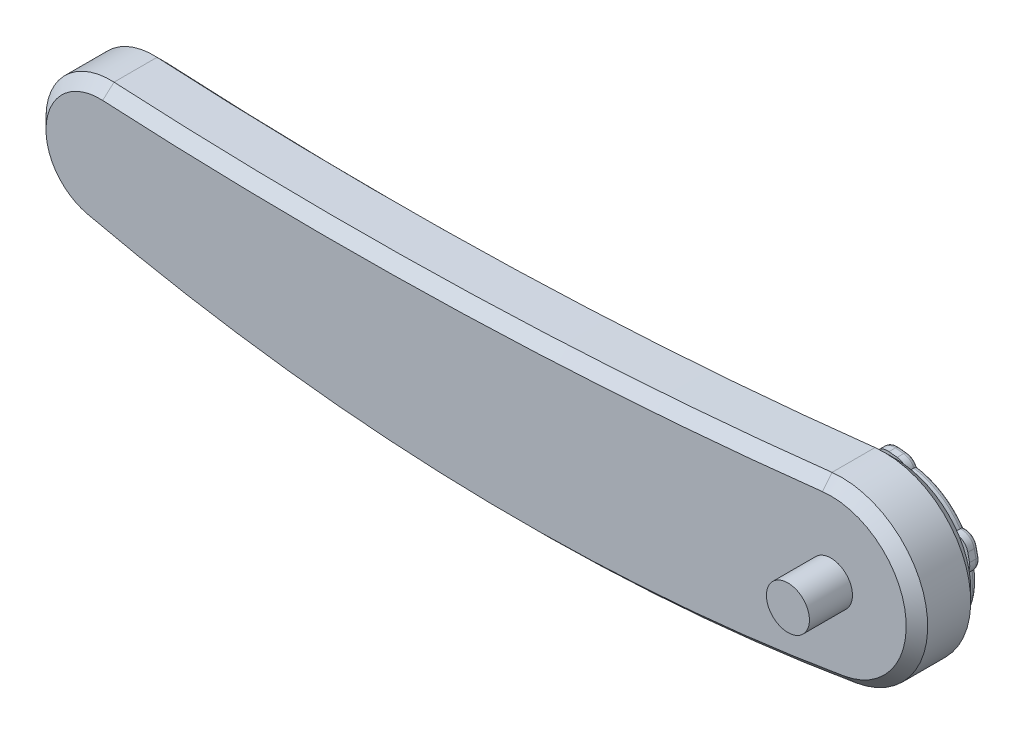
from build123d import *

# Parameters (mm, degrees)
BOSS_EXTRUDE2_DEPTH = 7.5
CHAMFER1_SIZE       = 2.5
SKETCH3_R           = 16.5
BOSS_EXTRUDE3_DEPTH = 2.5
BOSS_EXTRUDE5_DEPTH = 2.5
FILLET5_R           = 1
SKETCH7_R           = 5
CUT_EXTRUDE1_DEPTH  = 10
SKETCH8_R           = 5
BOSS_EXTRUDE6_DEPTH = 10


with BuildPart() as part:
    # Sketch1 → Boss-Extrude2 (new, symmetric)
    with BuildSketch(Plane.XY):
        with BuildLine():
            ThreePointArc((82.746539792, 19.872642429), (-0.617423728, 13.934366249), (-84.186105477, 14.977902914))
            ThreePointArc((-84.186105477, 14.977902914), (-99.852333231, 2.099570811), (-88.369675456, -14.61660998))
            ThreePointArc((-88.369675456, -14.61660998), (-0.256800738, -25.931146508), (88.361833105, -19.715427415))
            ThreePointArc((88.361833105, -19.715427415), (104.801791361, 2.808746854), (82.746539792, 19.872642429))
        make_face()
    extrude(amount=BOSS_EXTRUDE2_DEPTH, both=True)

    # Chamfer1
    chamfer1_edges = [part.edges().sort_by_distance(p)[0] for p in [
        (104.801791361, 2.808746854, 7.5),
        (-0.617423728, 13.934366249, 7.5),
        (-99.852333231, 2.099570811, 7.5),
        (-0.256800738, -25.931146508, 7.5),
        (-99.852333231, 2.099570811, -7.5),
        (-0.617423728, 13.934366249, -7.5),
        (104.801791361, 2.808746854, -7.5),
        (-0.256800738, -25.931146508, -7.5),
    ]]
    chamfer(chamfer1_edges, length=CHAMFER1_SIZE)

    # Sketch3 → Boss-Extrude3 (add, symmetric)
    with BuildSketch(Plane(origin=(0, 0, -7.5), x_dir=(-1, 0, 0), z_dir=(0, 0, -1))):
        with Locations(Location((-85, 0, 0), (0, 0, 180))):
            Circle(SKETCH3_R)
    extrude(amount=BOSS_EXTRUDE3_DEPTH, both=True)

    # Sketch4 → Boss-Extrude5 (add)
    with BuildSketch(Plane(origin=(0, 0, -10), x_dir=(-1, 0, 0), z_dir=(0, 0, -1))):
        with BuildLine():
            ThreePointArc((-83, 0), (-83.000002562, -0.003200998), (-83.000010246, -0.006401988))
            Line((-83.000010246, -0.006401988), (-69.992148283, -0.048040289))
            ThreePointArc((-69.992148283, -0.048040289), (-69.222420502, 0.049839883), (-68.503541809, 0.341858391))
            ThreePointArc((-68.503541809, 0.341858391), (-68.660652518, 2.296894393), (-69.048635628, 4.21947564))
            Line((-69.048635628, 4.21947564), (-83.066501288, 0.511451593))
            ThreePointArc((-83.066501288, 0.511451593), (-83.016695003, 0.257878437), (-83, 0))
        make_face()
        with BuildLine():
            Line((-72.257407456, 7.302653999), (-83.264757072, 0.994450593))
            ThreePointArc((-83.264757072, 0.994450593), (-83.149800467, 0.759448278), (-83.066501288, 0.511451593))
            Line((-83.066501288, 0.511451593), (-69.048635628, 4.21947564))
            ThreePointArc((-69.048635628, 4.21947564), (-69.624139876, 5.98606093), (-70.394604311, 7.676745193))
            ThreePointArc((-70.394604311, 7.676745193), (-71.356403527, 7.641065969), (-72.257407456, 7.302653999))
        make_face()
        with BuildLine():
            Line((-67.452313335, 4.641736889), (-69.048635628, 4.21947564))
            ThreePointArc((-69.048635628, 4.21947564), (-68.660652518, 2.296894393), (-68.503541809, 0.341858391))
            ThreePointArc((-68.503541809, 0.341858391), (-67.13202017, 2.016793833), (-67.244824085, 4.178680883))
            Line((-67.244824085, 4.178680883), (-67.452313335, 4.641736889))
        make_face()
        with BuildLine():
            ThreePointArc((-70.394604311, 7.676745193), (-69.624139876, 5.98606093), (-69.048635628, 4.21947564))
            Line((-69.048635628, 4.21947564), (-67.452313335, 4.641736889))
            Line((-67.452313335, 4.641736889), (-68.02801035, 5.926526149))
            ThreePointArc((-68.02801035, 5.926526149), (-68.981901031, 7.111832024), (-70.394604311, 7.676745193))
        make_face()
        with BuildLine():
            ThreePointArc((-85.409559162, 1.957616227), (-84.88893541, 1.996913783), (-84.375880525, 1.900124965))
            Line((-84.375880525, 1.900124965), (-80.316629741, 14.258469905))
            ThreePointArc((-80.316629741, 14.258469905), (-80.17186035, 15.020771163), (-80.227440722, 15.794704111))
            ThreePointArc((-80.227440722, 15.794704111), (-83.980346955, 16.468464035), (-87.787703063, 16.262801469))
            ThreePointArc((-87.787703063, 16.262801469), (-88.050982407, 15.33705057), (-88.007559024, 14.375569864))
            Line((-88.007559024, 14.375569864), (-85.409559162, 1.957616227))
        make_face()
        with BuildLine():
            ThreePointArc((-87.787703063, 16.262801469), (-83.980346955, 16.468464035), (-80.227440722, 15.794704111))
            ThreePointArc((-80.227440722, 15.794704111), (-81.396575494, 17.616682219), (-83.487510587, 18.177459159))
            Line((-83.487510587, 18.177459159), (-85.391828083, 17.972718648))
            ThreePointArc((-85.391828083, 17.972718648), (-86.81388939, 17.43179436), (-87.787703063, 16.262801469))
        make_face()
        with BuildLine():
            ThreePointArc((-86.988364411, 0.215422773), (-86.86485702, 0.722708998), (-86.614262705, 1.180743799))
            Line((-86.614262705, 1.180743799), (-97.113369715, 8.860259318))
            ThreePointArc((-97.113369715, 8.860259318), (-97.793625092, 9.233507233), (-98.546854344, 9.419805592))
            ThreePointArc((-98.546854344, 9.419805592), (-100.347349914, 6.058782931), (-101.328290932, 2.374218867))
            ThreePointArc((-101.328290932, 2.374218867), (-100.529207299, 1.837752571), (-99.601366244, 1.581936784))
            Line((-99.601366244, 1.581936784), (-86.988364411, 0.215422773))
        make_face()
        with BuildLine():
            ThreePointArc((-101.328290932, 2.374218867), (-100.347349914, 6.058782931), (-98.546854344, 9.419805592))
            ThreePointArc((-98.546854344, 9.419805592), (-100.64094101, 8.870914548), (-101.82040605, 7.055606707))
            Line((-101.82040605, 7.055606707), (-102.214152722, 5.181224846))
            ThreePointArc((-102.214152722, 5.181224846), (-102.139144264, 3.661609376), (-101.328290932, 2.374218867))
        make_face()
        with BuildLine():
            ThreePointArc((-85.819317626, -1.824477632), (-86.263609613, -1.550255058), (-86.621788693, -1.170385165))
            Line((-86.621788693, -1.170385165), (-97.169844461, -8.782528498))
            ThreePointArc((-97.169844461, -8.782528498), (-97.735034796, -9.314149858), (-98.144975703, -9.972944087))
            ThreePointArc((-98.144975703, -9.972944087), (-95.50483693, -12.723930253), (-92.303735712, -14.795453513))
            ThreePointArc((-92.303735712, -14.795453513), (-91.546595522, -14.201257019), (-91.016581597, -13.397879163))
            Line((-91.016581597, -13.397879163), (-85.819317626, -1.824477632))
        make_face()
        with BuildLine():
            ThreePointArc((-92.303735712, -14.795453513), (-95.50483693, -12.723930253), (-98.144975703, -9.972944087))
            ThreePointArc((-98.144975703, -9.972944087), (-98.270057666, -12.134155517), (-96.908072057, -13.816854403))
            Line((-96.908072057, -13.816854403), (-95.247103387, -14.77054559))
            ThreePointArc((-95.247103387, -14.77054559), (-93.778684303, -15.168795312), (-92.303735712, -14.795453513))
        make_face()
        with BuildLine():
            ThreePointArc((-83.51800173, -1.343011961), (-83.916096669, -1.680819315), (-84.38805783, -1.904081611))
            Line((-84.38805783, -1.904081611), (-80.4080078, -14.288160437))
            ThreePointArc((-80.4080078, -14.288160437), (-80.07705926, -14.989968422), (-79.577187422, -15.583424006))
            ThreePointArc((-79.577187422, -15.583424006), (-76.144996354, -13.922604298), (-73.185665982, -11.518312017))
            ThreePointArc((-73.185665982, -11.518312017), (-73.516811244, -10.614612091), (-74.117085679, -9.862281484))
            Line((-74.117085679, -9.862281484), (-83.51800173, -1.343011961))
        make_face()
        with BuildLine():
            ThreePointArc((-73.185665982, -11.518312017), (-76.144996354, -13.922604298), (-79.577187422, -15.583424006))
            ThreePointArc((-79.577187422, -15.583424006), (-77.560405661, -16.370235082), (-75.539187221, -15.594892345))
            Line((-75.539187221, -15.594892345), (-74.118905457, -14.309924053))
            ThreePointArc((-74.118905457, -14.309924053), (-73.286381012, -13.036440447), (-73.185665982, -11.518312017))
        make_face()
    extrude(amount=-BOSS_EXTRUDE5_DEPTH)

    # Fillet5
    # the kernel refuses this fillet: 1 mm, written as the material it takes off along each edge
    with BuildSketch(Plane(origin=(85, 0, -10), x_dir=(0.6962981474902139, -0.7177526661752616, 0), z_dir=(-0.7177526661752616, -0.6962981474902139, 0))) as fillet5_piece_1_section:
        with BuildLine():
            CenterArc((16.5 - FILLET5_R, FILLET5_R), FILLET5_R, 270, 90)
            Line((16.5, FILLET5_R), (16.5, 0))
            Line((16.5, 0), (16.5 - FILLET5_R, 0))
        make_face()
    fillet5_piece_1 = revolve(axis=Axis((85, 0, -10), (0, 0, 1)), revolution_arc=62.824440694, mode=Mode.PRIVATE)
    fillet5_piece_1 = fillet5_piece_1 - Plane(origin=(95.414266714, -11.215211538, -9.717562779), x_dir=(0.5851925824459815, 0.810894346663117, 0), z_dir=(0, 0, -1)) * Cylinder(3, 67, mode=Mode.PRIVATE)
    fillet5_piece_1 = fillet5_piece_1 - Plane(origin=(99.278232085, 4.5644834, -9.717562779), x_dir=(0.6833529490697156, -0.7300881775496182, 0), z_dir=(0, 0, -1)) * Cylinder(3, 67, mode=Mode.PRIVATE)
    add(fillet5_piece_1, mode=Mode.SUBTRACT)
    with BuildSketch(Plane(origin=(98.884485413, 6.43886526, -10), x_dir=(-0.8113230423185704, 0.5845980850147727, 0), z_dir=(-0.5845980850147727, -0.8113230423185704, 0))) as fillet5_piece_2_section:
        with BuildLine():
            CenterArc((3 - FILLET5_R, -FILLET5_R), FILLET5_R, 0, 90)
            Line((3, -FILLET5_R), (3, 0))
            Line((3, 0), (3 - FILLET5_R, 0))
        make_face()
    fillet5_piece_2 = revolve(axis=Axis((98.884485413, 6.43886526, -10), (0, 0, -1)), revolution_arc=132.361916339, mode=Mode.PRIVATE)
    fillet5_piece_2 = fillet5_piece_2 - Plane(origin=(85, 0, -9.714209438), x_dir=(1, 0, 0), z_dir=(0, 0, -1)) * Cylinder(16.5, 12, mode=Mode.PRIVATE)
    add(fillet5_piece_2, mode=Mode.SUBTRACT)
    with BuildSketch(Plane(origin=(101.82040605, 7.055606707, -10), x_dir=(-0.9786402124130847, -0.20558048216713717, 0), z_dir=(0.20558048216713717, -0.9786402124130846, 0)), Plane(origin=(96.908072057, -13.816854403, -10), x_dir=(-0.497935114202508, 0.8672142884224956, 0), z_dir=(-0.8672142884224956, -0.497935114202508, 0)), Plane(origin=(75.539187221, -15.594892345, -10), x_dir=(0.6708993876438742, 0.7415483879417947, 0), z_dir=(-0.7415483879417948, 0.6708993876438744, 0)), Plane(origin=(67.244824085, 4.178680883, -10), x_dir=(0.9125737387979128, -0.4089121803717751, 0), z_dir=(0.40891218037177507, 0.9125737387979127, 0)), Plane(origin=(83.487510587, 18.177459159, -10), x_dir=(-0.10689779982619077, -0.9942700138253792, 0), z_dir=(0.9942700138253792, -0.10689779982619077, 0))) as fillet5_piece_3:
        with BuildLine():
            CenterArc((FILLET5_R, -FILLET5_R), FILLET5_R, 90, 90)
            Line((0, -FILLET5_R), (0, 0))
            Line((0, 0), (FILLET5_R, 0))
        make_face()
    extrude(amount=1.915292093, mode=Mode.SUBTRACT)
    with BuildSketch(Plane(origin=(99.278232085, 4.5644834, -10), x_dir=(0.9786402124130815, 0.20558048216715175, 0), z_dir=(-0.20558048216715175, 0.9786402124130815, 0))) as fillet5_piece_4_section:
        with BuildLine():
            CenterArc((3 - FILLET5_R, -FILLET5_R), FILLET5_R, 0, 90)
            Line((3, -FILLET5_R), (3, 0))
            Line((3, 0), (3 - FILLET5_R, 0))
        make_face()
    fillet5_piece_4 = revolve(axis=Axis((99.278232085, 4.5644834, -10), (0, 0, -1)), revolution_arc=106.511925479, mode=Mode.PRIVATE)
    fillet5_piece_4 = fillet5_piece_4 - Plane(origin=(85, 0, -9.755871089), x_dir=(1, 0, 0), z_dir=(0, 0, -1)) * Cylinder(16.5, 12, mode=Mode.PRIVATE)
    add(fillet5_piece_4, mode=Mode.SUBTRACT)
    with BuildSketch(Plane(origin=(85, 0, -10), x_dir=(0.5729356734590134, -0.8196003380172965, 0), z_dir=(0.8196003380172965, 0.5729356734590134, 0))) as fillet5_piece_5_section:
        with BuildLine():
            CenterArc((16.5 - FILLET5_R, -FILLET5_R), FILLET5_R, 0, 90)
            Line((16.5, -FILLET5_R), (16.5, 0))
            Line((16.5, 0), (16.5 - FILLET5_R, 0))
        make_face()
    fillet5_piece_5 = revolve(axis=Axis((85, 0, -10), (0, 0, -1)), revolution_arc=62.824440694, mode=Mode.PRIVATE)
    fillet5_piece_5 = fillet5_piece_5 - Plane(origin=(93.753298045, -12.168902725, -9.717562776), x_dir=(-0.48318744431003685, -0.875516929397219, 0), z_dir=(0, 0, -1)) * Cylinder(3, 67, mode=Mode.PRIVATE)
    fillet5_piece_5 = fillet5_piece_5 - Plane(origin=(77.551885384, -13.370247181, -9.717562776), x_dir=(0.9520408053788243, -0.3059710850613826, 0), z_dir=(0, 0, -1)) * Cylinder(3, 67, mode=Mode.PRIVATE)
    add(fillet5_piece_5, mode=Mode.SUBTRACT)
    with BuildSketch(Plane(origin=(95.414266714, -11.215211538, -10), x_dir=(0.30527321016238146, 0.9522648093661523, 0), z_dir=(-0.9522648093661523, 0.30527321016238146, 0))) as fillet5_piece_6_section:
        with BuildLine():
            CenterArc((3 - FILLET5_R, -FILLET5_R), FILLET5_R, 0, 90)
            Line((3, -FILLET5_R), (3, 0))
            Line((3, 0), (3 - FILLET5_R, 0))
        make_face()
    fillet5_piece_6 = revolve(axis=Axis((95.414266714, -11.215211538, -10), (0, 0, -1)), revolution_arc=132.361916339, mode=Mode.PRIVATE)
    fillet5_piece_6 = fillet5_piece_6 - Plane(origin=(85, 0, -9.714209438), x_dir=(1, 0, 0), z_dir=(0, 0, -1)) * Cylinder(16.5, 13, mode=Mode.PRIVATE)
    add(fillet5_piece_6, mode=Mode.SUBTRACT)
    with BuildSketch(Plane(origin=(93.753298045, -12.168902725, -10), x_dir=(-0.9729714728157141, -0.23092534093689285, 0), z_dir=(-0.23092534093689285, 0.9729714728157141, 0))) as fillet5_piece_7_section:
        with BuildLine():
            CenterArc((3 - FILLET5_R, FILLET5_R), FILLET5_R, 270, 90)
            Line((3 - FILLET5_R, 0), (3, 0))
            Line((3, 0), (3, FILLET5_R))
        make_face()
    fillet5_piece_7 = revolve(axis=Axis((93.753298045, -12.168902725, -10), (0, 0, 1)), revolution_arc=106.511925479, mode=Mode.PRIVATE)
    fillet5_piece_7 = fillet5_piece_7 - Plane(origin=(85, 0, -9.755871036), x_dir=(1, 0, 0), z_dir=(0, 0, -1)) * Cylinder(16.5, 12, mode=Mode.PRIVATE)
    add(fillet5_piece_7, mode=Mode.SUBTRACT)
    with BuildSketch(Plane(origin=(85, 0, -10), x_dir=(-0.6024393824466099, -0.7981646387039125, 0), z_dir=(0.7981646387039125, -0.6024393824466099, 0))) as fillet5_piece_8_section:
        with BuildLine():
            CenterArc((16.5 - FILLET5_R, -FILLET5_R), FILLET5_R, 0, 90)
            Line((16.5, -FILLET5_R), (16.5, 0))
            Line((16.5, 0), (16.5 - FILLET5_R, 0))
        make_face()
    fillet5_piece_8 = revolve(axis=Axis((85, 0, -10), (0, 0, -1)), revolution_arc=62.824440694, mode=Mode.PRIVATE)
    fillet5_piece_8 = fillet5_piece_8 - Plane(origin=(76.13160362, -12.085278889, -9.717562776), x_dir=(-0.981979212590304, 0.1889889574565848, 0), z_dir=(0, 0, -1)) * Cylinder(3, 67, mode=Mode.PRIVATE)
    fillet5_piece_8 = fillet5_piece_8 - Plane(origin=(69.982545301, 2.951944342, -9.717562776), x_dir=(0.003200993954957648, -0.9999948768057266, 0), z_dir=(0, 0, -1)) * Cylinder(3, 67, mode=Mode.PRIVATE)
    add(fillet5_piece_8, mode=Mode.SUBTRACT)
    with BuildSketch(Plane(origin=(77.551885384, -13.370247181, -10), x_dir=(0.9999922620538119, 0.003933933464149582, 0), z_dir=(-0.003933933464149582, 0.9999922620538119, 0))) as fillet5_piece_9_section:
        with BuildLine():
            CenterArc((3 - FILLET5_R, -FILLET5_R), FILLET5_R, 0, 90)
            Line((3, -FILLET5_R), (3, 0))
            Line((3, 0), (3 - FILLET5_R, 0))
        make_face()
    fillet5_piece_9 = revolve(axis=Axis((77.551885384, -13.370247181, -10), (0, 0, -1)), revolution_arc=132.361916339, mode=Mode.PRIVATE)
    fillet5_piece_9 = fillet5_piece_9 - Plane(origin=(85, 0, -9.714209438), x_dir=(1, 0, 0), z_dir=(0, 0, -1)) * Cylinder(16.5, 13, mode=Mode.PRIVATE)
    add(fillet5_piece_9, mode=Mode.SUBTRACT)
    with BuildSketch(Plane(origin=(76.13160362, -12.085278889, -10), x_dir=(-0.6708993876438603, -0.7415483879418073, 0), z_dir=(0.7415483879418073, -0.6708993876438603, 0))) as fillet5_piece_10_section:
        with BuildLine():
            CenterArc((3 - FILLET5_R, -FILLET5_R), FILLET5_R, 0, 90)
            Line((3, -FILLET5_R), (3, 0))
            Line((3, 0), (3 - FILLET5_R, 0))
        make_face()
    fillet5_piece_10 = revolve(axis=Axis((76.13160362, -12.085278889, -10), (0, 0, -1)), revolution_arc=106.511925479, mode=Mode.PRIVATE)
    fillet5_piece_10 = fillet5_piece_10 - Plane(origin=(85, 0, -9.755871089), x_dir=(1, 0, 0), z_dir=(0, 0, -1)) * Cylinder(16.5, 12, mode=Mode.PRIVATE)
    add(fillet5_piece_10, mode=Mode.SUBTRACT)
    with BuildSketch(Plane(origin=(85, 0, -10), x_dir=(-0.945263687972474, 0.32630746268002736, 0), z_dir=(-0.32630746268002736, -0.945263687972474, 0))) as fillet5_piece_11_section:
        with BuildLine():
            CenterArc((16.5 - FILLET5_R, -FILLET5_R), FILLET5_R, 0, 90)
            Line((16.5, -FILLET5_R), (16.5, 0))
            Line((16.5, 0), (16.5 - FILLET5_R, 0))
        make_face()
    fillet5_piece_11 = revolve(axis=Axis((85, 0, -10), (0, 0, -1)), revolution_arc=62.824440694, mode=Mode.PRIVATE)
    fillet5_piece_11 = fillet5_piece_11 - Plane(origin=(70.765731567, 4.699789608, -9.717562776), x_dir=(-0.12370908531668448, 0.9923185286036482, 0), z_dir=(0, 0, -1)) * Cylinder(3, 67, mode=Mode.PRIVATE)
    fillet5_piece_11 = fillet5_piece_11 - Plane(origin=(83.166817188, 15.194649118, -9.717562776), x_dir=(-0.9500624823168781, -0.31205973738034826, 0), z_dir=(0, 0, -1)) * Cylinder(3, 67, mode=Mode.PRIVATE)
    add(fillet5_piece_11, mode=Mode.SUBTRACT)
    with BuildSketch(Plane(origin=(69.982545301, 2.951944342, -10), x_dir=(0.31275599627378403, -0.9498335047758596, 0), z_dir=(0.9498335047758596, 0.31275599627378403, 0))) as fillet5_piece_12_section:
        with BuildLine():
            CenterArc((3 - FILLET5_R, -FILLET5_R), FILLET5_R, 0, 90)
            Line((3, -FILLET5_R), (3, 0))
            Line((3, 0), (3 - FILLET5_R, 0))
        make_face()
    fillet5_piece_12 = revolve(axis=Axis((69.982545301, 2.951944342, -10), (0, 0, -1)), revolution_arc=132.361916339, mode=Mode.PRIVATE)
    fillet5_piece_12 = fillet5_piece_12 - Plane(origin=(85, 0, -9.714209438), x_dir=(1, 0, 0), z_dir=(0, 0, -1)) * Cylinder(16.5, 13, mode=Mode.PRIVATE)
    add(fillet5_piece_12, mode=Mode.SUBTRACT)
    with BuildSketch(Plane(origin=(70.765731567, 4.699789608, -10), x_dir=(-0.9125737387979147, 0.4089121803717705, 0), z_dir=(-0.4089121803717705, -0.9125737387979147, 0))) as fillet5_piece_13_section:
        with BuildLine():
            CenterArc((3 - FILLET5_R, -FILLET5_R), FILLET5_R, 0, 90)
            Line((3, -FILLET5_R), (3, 0))
            Line((3, 0), (3 - FILLET5_R, 0))
        make_face()
    fillet5_piece_13 = revolve(axis=Axis((70.765731567, 4.699789608, -10), (0, 0, -1)), revolution_arc=106.511925479, mode=Mode.PRIVATE)
    fillet5_piece_13 = fillet5_piece_13 - Plane(origin=(85, 0, -9.755871089), x_dir=(1, 0, 0), z_dir=(0, 0, -1)) * Cylinder(16.5, 13, mode=Mode.PRIVATE)
    add(fillet5_piece_13, mode=Mode.SUBTRACT)
    with BuildSketch(Plane(origin=(85, 0, -10), x_dir=(0.01823429494850894, 0.9998337414229083, 0), z_dir=(-0.9998337414229083, 0.01823429494850894, 0))) as fillet5_piece_14_section:
        with BuildLine():
            CenterArc((16.5 - FILLET5_R, -FILLET5_R), FILLET5_R, 0, 90)
            Line((16.5, -FILLET5_R), (16.5, 0))
            Line((16.5, 0), (16.5 - FILLET5_R, 0))
        make_face()
    fillet5_piece_14 = revolve(axis=Axis((85, 0, -10), (0, 0, -1)), revolution_arc=62.824440694, mode=Mode.PRIVATE)
    fillet5_piece_14 = fillet5_piece_14 - Plane(origin=(98.884485413, 6.43886526, -9.717562776), x_dir=(-0.590371899462906, 0.8071313525842994, 0), z_dir=(0, 0, -1)) * Cylinder(3, 67, mode=Mode.PRIVATE)
    fillet5_piece_14 = fillet5_piece_14 - Plane(origin=(85.071134683, 14.989908607, -9.717562776), x_dir=(0.9055227931474359, 0.4242976208871151, 0), z_dir=(0, 0, -1)) * Cylinder(3, 67, mode=Mode.PRIVATE)
    add(fillet5_piece_14, mode=Mode.SUBTRACT)
    with BuildSketch(Plane(origin=(83.166817188, 15.194649118, -10), x_dir=(-0.8066984261714545, -0.5909633230687827, 0), z_dir=(0.5909633230687827, -0.8066984261714545, 0))) as fillet5_piece_15_section:
        with BuildLine():
            CenterArc((3 - FILLET5_R, -FILLET5_R), FILLET5_R, 0, 90)
            Line((3, -FILLET5_R), (3, 0))
            Line((3, 0), (3 - FILLET5_R, 0))
        make_face()
    fillet5_piece_15 = revolve(axis=Axis((83.166817188, 15.194649118, -10), (0, 0, -1)), revolution_arc=132.361916339, mode=Mode.PRIVATE)
    fillet5_piece_15 = fillet5_piece_15 - Plane(origin=(85, 0, -9.714209438), x_dir=(1, 0, 0), z_dir=(0, 0, -1)) * Cylinder(16.5, 12, mode=Mode.PRIVATE)
    add(fillet5_piece_15, mode=Mode.SUBTRACT)
    with BuildSketch(Plane(origin=(85.071134683, 14.989908607, -10), x_dir=(0.106897799826194, 0.9942700138253789, 0), z_dir=(-0.9942700138253789, 0.106897799826194, 0))) as fillet5_piece_16_section:
        with BuildLine():
            CenterArc((3 - FILLET5_R, -FILLET5_R), FILLET5_R, 0, 90)
            Line((3, -FILLET5_R), (3, 0))
            Line((3, 0), (3 - FILLET5_R, 0))
        make_face()
    fillet5_piece_16 = revolve(axis=Axis((85.071134683, 14.989908607, -10), (0, 0, -1)), revolution_arc=106.511925479, mode=Mode.PRIVATE)
    fillet5_piece_16 = fillet5_piece_16 - Plane(origin=(85, 0, -9.755871089), x_dir=(1, 0, 0), z_dir=(0, 0, -1)) * Cylinder(16.5, 13, mode=Mode.PRIVATE)
    add(fillet5_piece_16, mode=Mode.SUBTRACT)
    with BuildSketch(Plane(origin=(85, 0, -10), x_dir=(0.6962981474902139, -0.7177526661752616, 0), z_dir=(-0.7177526661752616, -0.6962981474902139, 0))) as fillet5_piece_17a_section:
        with BuildLine():
            CenterArc((16.5 - FILLET5_R, FILLET5_R), FILLET5_R, 270, 90)
            Line((16.5, FILLET5_R), (16.5, 0))
            Line((16.5, 0), (16.5 - FILLET5_R, 0))
        make_face()
    fillet5_piece_17a = revolve(axis=Axis((85, 0, -10), (0, 0, 1)), revolution_arc=62.824440694, mode=Mode.PRIVATE)
    fillet5_piece_17a = fillet5_piece_17a & Plane(origin=(95.414266714, -11.215211538, -9.776380547), x_dir=(0.5851925824459815, 0.810894346663117, 0), z_dir=(0, 0, -1)) * Cylinder(3, 67, mode=Mode.PRIVATE)
    with BuildSketch(Plane(origin=(95.414266714, -11.215211538, -10), x_dir=(0.30527321016238146, 0.9522648093661523, 0), z_dir=(-0.9522648093661523, 0.30527321016238146, 0))) as fillet5_piece_17b_section:
        with BuildLine():
            CenterArc((3 - FILLET5_R, -FILLET5_R), FILLET5_R, 0, 90)
            Line((3, -FILLET5_R), (3, 0))
            Line((3, 0), (3 - FILLET5_R, 0))
        make_face()
    fillet5_piece_17b = revolve(axis=Axis((95.414266714, -11.215211538, -10), (0, 0, -1)), revolution_arc=132.361916339, mode=Mode.PRIVATE)
    fillet5_piece_17b = fillet5_piece_17b & Plane(origin=(85, 0, -9.770212373), x_dir=(1, 0, 0), z_dir=(0, 0, -1)) * Cylinder(16.5, 13, mode=Mode.PRIVATE)
    fillet5_piece_17 = fillet5_piece_17a & fillet5_piece_17b
    add(fillet5_piece_17, mode=Mode.SUBTRACT)
    with BuildSketch(Plane(origin=(99.278232085, 4.5644834, -10), x_dir=(0.9786402124130815, 0.20558048216715175, 0), z_dir=(-0.20558048216715175, 0.9786402124130815, 0))) as fillet5_piece_18a_section:
        with BuildLine():
            CenterArc((3 - FILLET5_R, -FILLET5_R), FILLET5_R, 0, 90)
            Line((3, -FILLET5_R), (3, 0))
            Line((3, 0), (3 - FILLET5_R, 0))
        make_face()
    fillet5_piece_18a = revolve(axis=Axis((99.278232085, 4.5644834, -10), (0, 0, -1)), revolution_arc=106.511925479, mode=Mode.PRIVATE)
    fillet5_piece_18a = fillet5_piece_18a & Plane(origin=(85, 0, -9.772218446), x_dir=(1, 0, 0), z_dir=(0, 0, -1)) * Cylinder(16.5, 12, mode=Mode.PRIVATE)
    with BuildSketch(Plane(origin=(85, 0, -10), x_dir=(0.6962981474902139, -0.7177526661752616, 0), z_dir=(-0.7177526661752616, -0.6962981474902139, 0))) as fillet5_piece_18b_section:
        with BuildLine():
            CenterArc((16.5 - FILLET5_R, FILLET5_R), FILLET5_R, 270, 90)
            Line((16.5, FILLET5_R), (16.5, 0))
            Line((16.5, 0), (16.5 - FILLET5_R, 0))
        make_face()
    fillet5_piece_18b = revolve(axis=Axis((85, 0, -10), (0, 0, 1)), revolution_arc=62.824440694, mode=Mode.PRIVATE)
    fillet5_piece_18b = fillet5_piece_18b & Plane(origin=(99.278232085, 4.5644834, -9.777758811), x_dir=(0.6833529490697156, -0.7300881775496182, 0), z_dir=(0, 0, -1)) * Cylinder(3, 67, mode=Mode.PRIVATE)
    fillet5_piece_18 = fillet5_piece_18a & fillet5_piece_18b
    add(fillet5_piece_18, mode=Mode.SUBTRACT)
    with BuildSketch(Plane(origin=(85, 0, -10), x_dir=(0.01823429494850894, 0.9998337414229083, 0), z_dir=(-0.9998337414229083, 0.01823429494850894, 0))) as fillet5_piece_19a_section:
        with BuildLine():
            CenterArc((16.5 - FILLET5_R, -FILLET5_R), FILLET5_R, 0, 90)
            Line((16.5, -FILLET5_R), (16.5, 0))
            Line((16.5, 0), (16.5 - FILLET5_R, 0))
        make_face()
    fillet5_piece_19a = revolve(axis=Axis((85, 0, -10), (0, 0, -1)), revolution_arc=62.824440694, mode=Mode.PRIVATE)
    fillet5_piece_19a = fillet5_piece_19a & Plane(origin=(98.884485413, 6.43886526, -9.776380543), x_dir=(-0.590371899462906, 0.8071313525842994, 0), z_dir=(0, 0, -1)) * Cylinder(3, 67, mode=Mode.PRIVATE)
    with BuildSketch(Plane(origin=(98.884485413, 6.43886526, -10), x_dir=(-0.8113230423185704, 0.5845980850147727, 0), z_dir=(-0.5845980850147727, -0.8113230423185704, 0))) as fillet5_piece_19b_section:
        with BuildLine():
            CenterArc((3 - FILLET5_R, -FILLET5_R), FILLET5_R, 0, 90)
            Line((3, -FILLET5_R), (3, 0))
            Line((3, 0), (3 - FILLET5_R, 0))
        make_face()
    fillet5_piece_19b = revolve(axis=Axis((98.884485413, 6.43886526, -10), (0, 0, -1)), revolution_arc=132.361916339, mode=Mode.PRIVATE)
    fillet5_piece_19b = fillet5_piece_19b & Plane(origin=(85, 0, -9.770212373), x_dir=(1, 0, 0), z_dir=(0, 0, -1)) * Cylinder(16.5, 12, mode=Mode.PRIVATE)
    fillet5_piece_19 = fillet5_piece_19a & fillet5_piece_19b
    add(fillet5_piece_19, mode=Mode.SUBTRACT)
    with BuildSketch(Plane(origin=(93.753298045, -12.168902725, -10), x_dir=(-0.9729714728157141, -0.23092534093689285, 0), z_dir=(-0.23092534093689285, 0.9729714728157141, 0))) as fillet5_piece_20a_section:
        with BuildLine():
            CenterArc((3 - FILLET5_R, FILLET5_R), FILLET5_R, 270, 90)
            Line((3 - FILLET5_R, 0), (3, 0))
            Line((3, 0), (3, FILLET5_R))
        make_face()
    fillet5_piece_20a = revolve(axis=Axis((93.753298045, -12.168902725, -10), (0, 0, 1)), revolution_arc=106.511925479, mode=Mode.PRIVATE)
    fillet5_piece_20a = fillet5_piece_20a & Plane(origin=(85, 0, -9.772218525), x_dir=(1, 0, 0), z_dir=(0, 0, -1)) * Cylinder(16.5, 12, mode=Mode.PRIVATE)
    with BuildSketch(Plane(origin=(85, 0, -10), x_dir=(0.5729356734590134, -0.8196003380172965, 0), z_dir=(0.8196003380172965, 0.5729356734590134, 0))) as fillet5_piece_20b_section:
        with BuildLine():
            CenterArc((16.5 - FILLET5_R, -FILLET5_R), FILLET5_R, 0, 90)
            Line((16.5, -FILLET5_R), (16.5, 0))
            Line((16.5, 0), (16.5 - FILLET5_R, 0))
        make_face()
    fillet5_piece_20b = revolve(axis=Axis((85, 0, -10), (0, 0, -1)), revolution_arc=62.824440694, mode=Mode.PRIVATE)
    fillet5_piece_20b = fillet5_piece_20b & Plane(origin=(93.753298045, -12.168902725, -9.777758803), x_dir=(-0.48318744431003685, -0.875516929397219, 0), z_dir=(0, 0, -1)) * Cylinder(3, 67, mode=Mode.PRIVATE)
    fillet5_piece_20 = fillet5_piece_20a & fillet5_piece_20b
    add(fillet5_piece_20, mode=Mode.SUBTRACT)
    with BuildSketch(Plane(origin=(85, 0, -10), x_dir=(0.5729356734590134, -0.8196003380172965, 0), z_dir=(0.8196003380172965, 0.5729356734590134, 0))) as fillet5_piece_21a_section:
        with BuildLine():
            CenterArc((16.5 - FILLET5_R, -FILLET5_R), FILLET5_R, 0, 90)
            Line((16.5, -FILLET5_R), (16.5, 0))
            Line((16.5, 0), (16.5 - FILLET5_R, 0))
        make_face()
    fillet5_piece_21a = revolve(axis=Axis((85, 0, -10), (0, 0, -1)), revolution_arc=62.824440694, mode=Mode.PRIVATE)
    fillet5_piece_21a = fillet5_piece_21a & Plane(origin=(77.551885384, -13.370247181, -9.776380543), x_dir=(0.9520408053788243, -0.3059710850613826, 0), z_dir=(0, 0, -1)) * Cylinder(3, 67, mode=Mode.PRIVATE)
    with BuildSketch(Plane(origin=(77.551885384, -13.370247181, -10), x_dir=(0.9999922620538119, 0.003933933464149582, 0), z_dir=(-0.003933933464149582, 0.9999922620538119, 0))) as fillet5_piece_21b_section:
        with BuildLine():
            CenterArc((3 - FILLET5_R, -FILLET5_R), FILLET5_R, 0, 90)
            Line((3, -FILLET5_R), (3, 0))
            Line((3, 0), (3 - FILLET5_R, 0))
        make_face()
    fillet5_piece_21b = revolve(axis=Axis((77.551885384, -13.370247181, -10), (0, 0, -1)), revolution_arc=132.361916339, mode=Mode.PRIVATE)
    fillet5_piece_21b = fillet5_piece_21b & Plane(origin=(85, 0, -9.770212373), x_dir=(1, 0, 0), z_dir=(0, 0, -1)) * Cylinder(16.5, 13, mode=Mode.PRIVATE)
    fillet5_piece_21 = fillet5_piece_21a & fillet5_piece_21b
    add(fillet5_piece_21, mode=Mode.SUBTRACT)
    with BuildSketch(Plane(origin=(76.13160362, -12.085278889, -10), x_dir=(-0.6708993876438603, -0.7415483879418073, 0), z_dir=(0.7415483879418073, -0.6708993876438603, 0))) as fillet5_piece_22a_section:
        with BuildLine():
            CenterArc((3 - FILLET5_R, -FILLET5_R), FILLET5_R, 0, 90)
            Line((3, -FILLET5_R), (3, 0))
            Line((3, 0), (3 - FILLET5_R, 0))
        make_face()
    fillet5_piece_22a = revolve(axis=Axis((76.13160362, -12.085278889, -10), (0, 0, -1)), revolution_arc=106.511925479, mode=Mode.PRIVATE)
    fillet5_piece_22a = fillet5_piece_22a & Plane(origin=(85, 0, -9.772218446), x_dir=(1, 0, 0), z_dir=(0, 0, -1)) * Cylinder(16.5, 12, mode=Mode.PRIVATE)
    with BuildSketch(Plane(origin=(85, 0, -10), x_dir=(-0.6024393824466099, -0.7981646387039125, 0), z_dir=(0.7981646387039125, -0.6024393824466099, 0))) as fillet5_piece_22b_section:
        with BuildLine():
            CenterArc((16.5 - FILLET5_R, -FILLET5_R), FILLET5_R, 0, 90)
            Line((16.5, -FILLET5_R), (16.5, 0))
            Line((16.5, 0), (16.5 - FILLET5_R, 0))
        make_face()
    fillet5_piece_22b = revolve(axis=Axis((85, 0, -10), (0, 0, -1)), revolution_arc=62.824440694, mode=Mode.PRIVATE)
    fillet5_piece_22b = fillet5_piece_22b & Plane(origin=(76.13160362, -12.085278889, -9.777758032), x_dir=(-0.981979212590304, 0.1889889574565848, 0), z_dir=(0, 0, -1)) * Cylinder(3, 67, mode=Mode.PRIVATE)
    fillet5_piece_22 = fillet5_piece_22a & fillet5_piece_22b
    add(fillet5_piece_22, mode=Mode.SUBTRACT)
    with BuildSketch(Plane(origin=(85, 0, -10), x_dir=(-0.6024393824466099, -0.7981646387039125, 0), z_dir=(0.7981646387039125, -0.6024393824466099, 0))) as fillet5_piece_23a_section:
        with BuildLine():
            CenterArc((16.5 - FILLET5_R, -FILLET5_R), FILLET5_R, 0, 90)
            Line((16.5, -FILLET5_R), (16.5, 0))
            Line((16.5, 0), (16.5 - FILLET5_R, 0))
        make_face()
    fillet5_piece_23a = revolve(axis=Axis((85, 0, -10), (0, 0, -1)), revolution_arc=62.824440694, mode=Mode.PRIVATE)
    fillet5_piece_23a = fillet5_piece_23a & Plane(origin=(69.982545301, 2.951944342, -9.776380543), x_dir=(0.003200993954957648, -0.9999948768057266, 0), z_dir=(0, 0, -1)) * Cylinder(3, 67, mode=Mode.PRIVATE)
    with BuildSketch(Plane(origin=(69.982545301, 2.951944342, -10), x_dir=(0.31275599627378403, -0.9498335047758596, 0), z_dir=(0.9498335047758596, 0.31275599627378403, 0))) as fillet5_piece_23b_section:
        with BuildLine():
            CenterArc((3 - FILLET5_R, -FILLET5_R), FILLET5_R, 0, 90)
            Line((3, -FILLET5_R), (3, 0))
            Line((3, 0), (3 - FILLET5_R, 0))
        make_face()
    fillet5_piece_23b = revolve(axis=Axis((69.982545301, 2.951944342, -10), (0, 0, -1)), revolution_arc=132.361916339, mode=Mode.PRIVATE)
    fillet5_piece_23b = fillet5_piece_23b & Plane(origin=(85, 0, -9.770212373), x_dir=(1, 0, 0), z_dir=(0, 0, -1)) * Cylinder(16.5, 13, mode=Mode.PRIVATE)
    fillet5_piece_23 = fillet5_piece_23a & fillet5_piece_23b
    add(fillet5_piece_23, mode=Mode.SUBTRACT)
    with BuildSketch(Plane(origin=(70.765731567, 4.699789608, -10), x_dir=(-0.9125737387979147, 0.4089121803717705, 0), z_dir=(-0.4089121803717705, -0.9125737387979147, 0))) as fillet5_piece_24a_section:
        with BuildLine():
            CenterArc((3 - FILLET5_R, -FILLET5_R), FILLET5_R, 0, 90)
            Line((3, -FILLET5_R), (3, 0))
            Line((3, 0), (3 - FILLET5_R, 0))
        make_face()
    fillet5_piece_24a = revolve(axis=Axis((70.765731567, 4.699789608, -10), (0, 0, -1)), revolution_arc=106.511925479, mode=Mode.PRIVATE)
    fillet5_piece_24a = fillet5_piece_24a & Plane(origin=(85, 0, -9.772218446), x_dir=(1, 0, 0), z_dir=(0, 0, -1)) * Cylinder(16.5, 13, mode=Mode.PRIVATE)
    with BuildSketch(Plane(origin=(85, 0, -10), x_dir=(-0.945263687972474, 0.32630746268002736, 0), z_dir=(-0.32630746268002736, -0.945263687972474, 0))) as fillet5_piece_24b_section:
        with BuildLine():
            CenterArc((16.5 - FILLET5_R, -FILLET5_R), FILLET5_R, 0, 90)
            Line((16.5, -FILLET5_R), (16.5, 0))
            Line((16.5, 0), (16.5 - FILLET5_R, 0))
        make_face()
    fillet5_piece_24b = revolve(axis=Axis((85, 0, -10), (0, 0, -1)), revolution_arc=62.824440694, mode=Mode.PRIVATE)
    fillet5_piece_24b = fillet5_piece_24b & Plane(origin=(70.765731567, 4.699789608, -9.777758803), x_dir=(-0.12370908531668448, 0.9923185286036482, 0), z_dir=(0, 0, -1)) * Cylinder(3, 67, mode=Mode.PRIVATE)
    fillet5_piece_24 = fillet5_piece_24a & fillet5_piece_24b
    add(fillet5_piece_24, mode=Mode.SUBTRACT)
    with BuildSketch(Plane(origin=(85, 0, -10), x_dir=(-0.945263687972474, 0.32630746268002736, 0), z_dir=(-0.32630746268002736, -0.945263687972474, 0))) as fillet5_piece_25a_section:
        with BuildLine():
            CenterArc((16.5 - FILLET5_R, -FILLET5_R), FILLET5_R, 0, 90)
            Line((16.5, -FILLET5_R), (16.5, 0))
            Line((16.5, 0), (16.5 - FILLET5_R, 0))
        make_face()
    fillet5_piece_25a = revolve(axis=Axis((85, 0, -10), (0, 0, -1)), revolution_arc=62.824440694, mode=Mode.PRIVATE)
    fillet5_piece_25a = fillet5_piece_25a & Plane(origin=(83.166817188, 15.194649118, -9.776380543), x_dir=(-0.9500624823168781, -0.31205973738034826, 0), z_dir=(0, 0, -1)) * Cylinder(3, 67, mode=Mode.PRIVATE)
    with BuildSketch(Plane(origin=(83.166817188, 15.194649118, -10), x_dir=(-0.8066984261714545, -0.5909633230687827, 0), z_dir=(0.5909633230687827, -0.8066984261714545, 0))) as fillet5_piece_25b_section:
        with BuildLine():
            CenterArc((3 - FILLET5_R, -FILLET5_R), FILLET5_R, 0, 90)
            Line((3, -FILLET5_R), (3, 0))
            Line((3, 0), (3 - FILLET5_R, 0))
        make_face()
    fillet5_piece_25b = revolve(axis=Axis((83.166817188, 15.194649118, -10), (0, 0, -1)), revolution_arc=132.361916339, mode=Mode.PRIVATE)
    fillet5_piece_25b = fillet5_piece_25b & Plane(origin=(85, 0, -9.770212373), x_dir=(1, 0, 0), z_dir=(0, 0, -1)) * Cylinder(16.5, 12, mode=Mode.PRIVATE)
    fillet5_piece_25 = fillet5_piece_25a & fillet5_piece_25b
    add(fillet5_piece_25, mode=Mode.SUBTRACT)
    with BuildSketch(Plane(origin=(85.071134683, 14.989908607, -10), x_dir=(0.106897799826194, 0.9942700138253789, 0), z_dir=(-0.9942700138253789, 0.106897799826194, 0))) as fillet5_piece_26a_section:
        with BuildLine():
            CenterArc((3 - FILLET5_R, -FILLET5_R), FILLET5_R, 0, 90)
            Line((3, -FILLET5_R), (3, 0))
            Line((3, 0), (3 - FILLET5_R, 0))
        make_face()
    fillet5_piece_26a = revolve(axis=Axis((85.071134683, 14.989908607, -10), (0, 0, -1)), revolution_arc=106.511925479, mode=Mode.PRIVATE)
    fillet5_piece_26a = fillet5_piece_26a & Plane(origin=(85, 0, -9.772218446), x_dir=(1, 0, 0), z_dir=(0, 0, -1)) * Cylinder(16.5, 13, mode=Mode.PRIVATE)
    with BuildSketch(Plane(origin=(85, 0, -10), x_dir=(0.01823429494850894, 0.9998337414229083, 0), z_dir=(-0.9998337414229083, 0.01823429494850894, 0))) as fillet5_piece_26b_section:
        with BuildLine():
            CenterArc((16.5 - FILLET5_R, -FILLET5_R), FILLET5_R, 0, 90)
            Line((16.5, -FILLET5_R), (16.5, 0))
            Line((16.5, 0), (16.5 - FILLET5_R, 0))
        make_face()
    fillet5_piece_26b = revolve(axis=Axis((85, 0, -10), (0, 0, -1)), revolution_arc=62.824440694, mode=Mode.PRIVATE)
    fillet5_piece_26b = fillet5_piece_26b & Plane(origin=(85.071134683, 14.989908607, -9.777758803), x_dir=(0.9055227931474359, 0.4242976208871151, 0), z_dir=(0, 0, -1)) * Cylinder(3, 67, mode=Mode.PRIVATE)
    fillet5_piece_26 = fillet5_piece_26a & fillet5_piece_26b
    add(fillet5_piece_26, mode=Mode.SUBTRACT)

    # Sketch7 → Cut-Extrude1 (cut)
    with BuildSketch(Plane(origin=(0, 0, -7.5), x_dir=(-1, 0, 0), z_dir=(0, 0, -1))):
        with Locations((85, 0)):
            Circle(SKETCH7_R)
    extrude(amount=-CUT_EXTRUDE1_DEPTH, mode=Mode.SUBTRACT)

    # Sketch8 → Boss-Extrude6 (add)
    with BuildSketch(Plane.XY.offset(7.5)):
        with Locations((85, 0)):
            Circle(SKETCH8_R)
    extrude(amount=BOSS_EXTRUDE6_DEPTH)


solid = part.part
